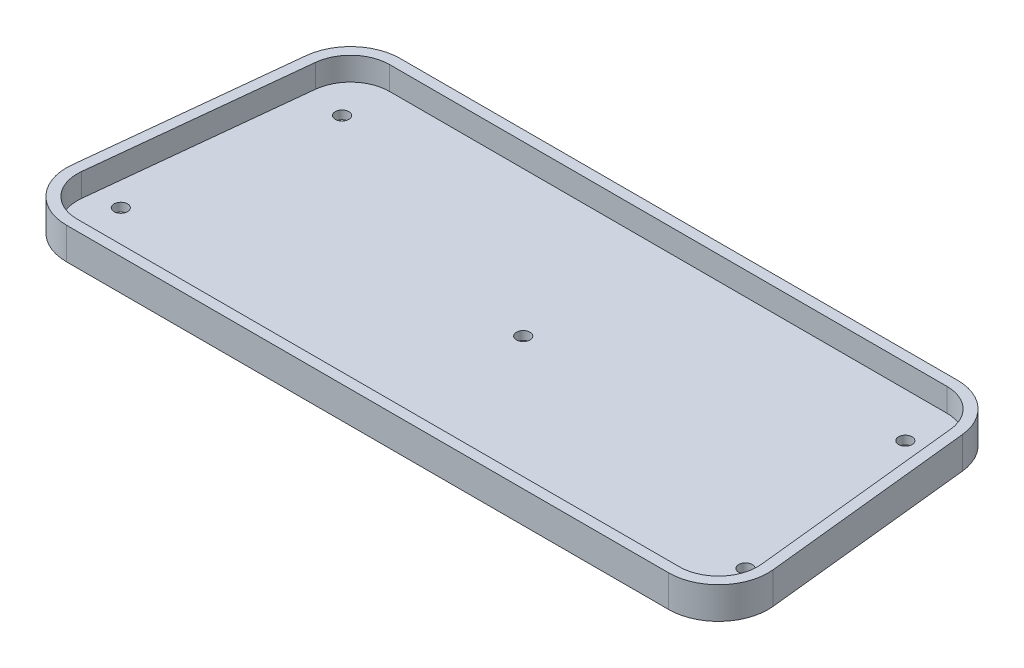
from build123d import *

# Parameters (mm, degrees)
SKETCH1_R           = 2.032
BOSS_EXTRUDE1_DEPTH = 2.54
BOSS_EXTRUDE2_DEPTH = 9.525


with BuildPart() as part:
    # Sketch1 → Boss-Extrude1 (new body)
    with BuildSketch(Plane(origin=(0, 0, 0), x_dir=(1, 0, 0), z_dir=(0, 1, 0))):
        with BuildLine():
            Line((-101.196460125, 62.269846472), (-107.93130861, -1.230153528))
            ThreePointArc((-107.93130861, -1.230153528), (-104.983139546, -10.325633674), (-96.249329296, -14.216651334))
            Line((-96.249329296, -14.216651334), (84.361550459, -14.216651334))
            ThreePointArc((84.361550459, -14.216651334), (93.095360709, -10.325633674), (96.043529773, -1.230153528))
            Line((96.043529773, -1.230153528), (89.308681288, 62.269846472))
            ThreePointArc((89.308681288, 62.269846472), (85.483184315, 69.764658916), (77.626701974, 72.778348666))
            Line((77.626701974, 72.778348666), (-89.514480811, 72.778348666))
            ThreePointArc((-89.514480811, 72.778348666), (-97.370963151, 69.764658916), (-101.196460125, 62.269846472))
        make_face()
        with Locations((78.523810582, 59.410328666)):
            Circle(SKETCH1_R, mode=Mode.SUBTRACT)
        with Locations((87.731310582, 2.260328666)):
            Circle(SKETCH1_R, mode=Mode.SUBTRACT)
        with Locations((-5.943889418, 29.280848666)):
            Circle(SKETCH1_R, mode=Mode.SUBTRACT)
        with Locations((-99.619089418, 2.260328666)):
            Circle(SKETCH1_R, mode=Mode.SUBTRACT)
        with Locations((-90.411589418, 59.410328666)):
            Circle(SKETCH1_R, mode=Mode.SUBTRACT)
    extrude(amount=BOSS_EXTRUDE1_DEPTH)

    # Sketch4 → Boss-Extrude2 (add)
    with BuildSketch(Plane.XZ):
        with BuildLine():
            Line((92.465972995, -62.604710744), (99.200821479, 0.895289256))
            ThreePointArc((99.200821479, 0.895289256), (95.455849966, 12.44900728), (84.361550459, 17.391651334))
            Line((84.361550459, 17.391651334), (-96.249329296, 17.391651334))
            ThreePointArc((-96.249329296, 17.391651334), (-107.343628803, 12.44900728), (-111.088600316, 0.895289256))
            Line((-111.088600316, 0.895289256), (-104.353751831, -62.604710744))
            ThreePointArc((-104.353751831, -62.604710744), (-99.494336757, -72.125148173), (-89.514480811, -75.953348666))
            Line((-89.514480811, -75.953348666), (77.626701974, -75.953348666))
            ThreePointArc((77.626701974, -75.953348666), (87.60655792, -72.125148173), (92.465972995, -62.604710744))
        make_face()
        with BuildLine():
            ThreePointArc((89.308681288, -62.269846472), (85.483184315, -69.764658916), (77.626701974, -72.778348666))
            Line((77.626701974, -72.778348666), (-89.514480811, -72.778348666))
            ThreePointArc((-89.514480811, -72.778348666), (-97.370963151, -69.764658916), (-101.196460125, -62.269846472))
            Line((-101.196460125, -62.269846472), (-107.93130861, 1.230153528))
            ThreePointArc((-107.93130861, 1.230153528), (-104.983139546, 10.325633674), (-96.249329296, 14.216651334))
            Line((-96.249329296, 14.216651334), (84.361550459, 14.216651334))
            ThreePointArc((84.361550459, 14.216651334), (93.095360709, 10.325633674), (96.043529773, 1.230153528))
            Line((96.043529773, 1.230153528), (89.308681288, -62.269846472))
        make_face(mode=Mode.SUBTRACT)
    extrude(amount=-BOSS_EXTRUDE2_DEPTH)


solid = part.part
